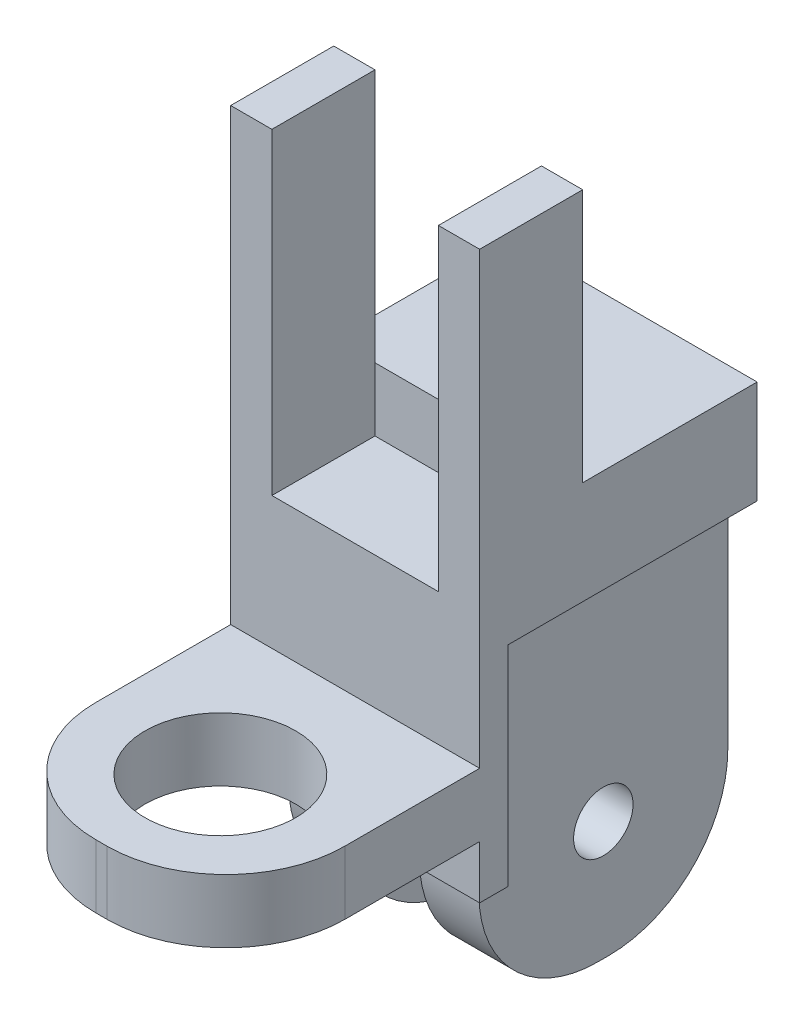
from build123d import *

# Parameters (mm, degrees)
SKETCH4_W            = 31.4
SKETCH4_H            = 31.4
SKETCH4_W_2          = 25.4
SKETCH4_H_2          = 25.4
BOSS_EXTRUDE3_DEPTH  = 30
SKETCH5_W            = 31.4
SKETCH5_H            = 31.4
BOSS_EXTRUDE4_DEPTH  = 5
SKETCH6_W            = 31.4
SKETCH6_H            = 8
BOSS_EXTRUDE5_DEPTH  = 5
BOSS_EXTRUDE6_DEPTH  = 8
SKETCH8_R            = 9.5
BOSS_EXTRUDE7_DEPTH  = 8
SKETCH9_W            = 31.4
SKETCH9_H            = 10
BOSS_EXTRUDE8_DEPTH  = 5
SKETCH10_W           = 31.4
SKETCH10_H           = 10
BOSS_EXTRUDE9_DEPTH  = 13
SKETCH11_W           = 5.2
SKETCH11_H           = 10
BOSS_EXTRUDE10_DEPTH = 40
BOSS_EXTRUDE11_DEPTH = 3
SKETCH13_W           = 31.4
SKETCH13_H           = 31.4
CUT_EXTRUDE1_DEPTH   = 31.4
SKETCH15_W           = 31.4
SKETCH15_H           = 13
BOSS_EXTRUDE12_DEPTH = 12
SKETCH17_W           = 7.5
SKETCH17_H           = 31.4
BOSS_EXTRUDE13_DEPTH = 10
SKETCH18_R           = 3.75
BOSS_EXTRUDE14_DEPTH = 7.5
SKETCH19_W           = 3.6
SKETCH19_H           = 5
CUT_EXTRUDE2_DEPTH   = 31.4
CUT_EXTRUDE3_START   = 8
SKETCH8_2_R          = 9.5
CUT_EXTRUDE3_DEPTH   = 24
SKETCH20_W           = 9
SKETCH20_H           = 1
CUT_EXTRUDE4_DEPTH   = 26.4


with BuildPart() as part:
    # Sketch4 → Boss-Extrude3 (new body)
    with BuildSketch(Plane.XY):
        Rectangle(SKETCH4_W, SKETCH4_H)
        Rectangle(SKETCH4_W_2, SKETCH4_H_2, mode=Mode.SUBTRACT)
    extrude(amount=BOSS_EXTRUDE3_DEPTH)

    # Sketch5 → Boss-Extrude4 (add)
    with BuildSketch(Plane.XY.offset(30)):
        Rectangle(SKETCH5_W, SKETCH5_H)
    extrude(amount=BOSS_EXTRUDE4_DEPTH)

    # Sketch6 → Boss-Extrude5 (add)
    with BuildSketch(Plane.XY.offset(35)):
        Rectangle(SKETCH6_W, SKETCH6_H)
    extrude(amount=BOSS_EXTRUDE5_DEPTH)

    # Sketch7 → Boss-Extrude6 (add)
    with BuildSketch(Plane.XZ.offset(4)):
        with BuildLine():
            Line((-15.7, 40), (-15.7, 52))
            ThreePointArc((-15.7, 52), (-11.306601718, 62.606601718), (-0.7, 67))
            Line((-0.7, 67), (0.7, 67))
            ThreePointArc((0.7, 67), (11.306601718, 62.606601718), (15.7, 52))
            Line((15.7, 52), (15.7, 40))
            Line((15.7, 40), (-15.7, 40))
        make_face()
    extrude(amount=-BOSS_EXTRUDE6_DEPTH)

    # Sketch8 → Boss-Extrude7 (add)
    with BuildSketch(Plane.XZ.offset(4)):
        with Locations((0, 52)):
            Circle(SKETCH8_R)
    boss_extrude7 = extrude(amount=BOSS_EXTRUDE7_DEPTH)

    # Mirror1: Boss-Extrude7 across plane
    add(boss_extrude7.mirror(Plane.ZX))

    # Sketch9 → Boss-Extrude8 (add)
    with BuildSketch(Plane(origin=(0, 15.7, 0), x_dir=(1, 0, 0), z_dir=(0, 1, 0))):
        with Locations((0, -27)):
            Rectangle(SKETCH9_W, SKETCH9_H)
    extrude(amount=BOSS_EXTRUDE8_DEPTH)

    # Sketch10 → Boss-Extrude9 (add)
    with BuildSketch(Plane(origin=(0, 15.7, 0), x_dir=(1, 0, 0), z_dir=(0, 1, 0))):
        with Locations((0, -17)):
            Rectangle(SKETCH10_W, SKETCH10_H)
    extrude(amount=BOSS_EXTRUDE9_DEPTH)

    # Sketch11 → Boss-Extrude10 (add)
    with BuildSketch(Plane(origin=(0, 20.7, 0), x_dir=(1, 0, 0), z_dir=(0, 1, 0))):
        with Locations((-13.1, -27)):
            Rectangle(SKETCH11_W, SKETCH11_H)
        with Locations((13.1, -27)):
            Rectangle(SKETCH11_W, SKETCH11_H)
    extrude(amount=BOSS_EXTRUDE10_DEPTH)

    # Sketch12 → Boss-Extrude11 (add)
    with BuildSketch(Plane.XY.offset(32)):
        Polygon((-15.7, 60.7), (-10.5, 60.7), (-10.5, 20.7), (10.5, 20.7), (10.5, 60.7), (15.7, 60.7), (15.7, 15.7), (-15.7, 15.7), align=None)
    extrude(amount=BOSS_EXTRUDE11_DEPTH)

    # Sketch13 → Cut-Extrude1 (cut)
    with BuildSketch(Plane.ZY.offset(15.7)):
        with Locations((15.7, 0)):
            Rectangle(SKETCH13_W, SKETCH13_H)
    extrude(amount=-CUT_EXTRUDE1_DEPTH, mode=Mode.SUBTRACT)

    # Sketch15 → Boss-Extrude12 (add)
    with BuildSketch(Plane(origin=(0, 0, 12), x_dir=(-1, 0, 0), z_dir=(0, 0, -1))):
        with Locations((0, 22.2)):
            Rectangle(SKETCH15_W, SKETCH15_H)
    extrude(amount=BOSS_EXTRUDE12_DEPTH)

    # Sketch17 → Boss-Extrude13 (add)
    with BuildSketch(Plane.XZ.offset(-15.7)):
        with Locations((-8.25, 15.7)):
            Rectangle(SKETCH17_W, SKETCH17_H)
    boss_extrude13 = extrude(amount=BOSS_EXTRUDE13_DEPTH)

    # Sketch18 → Boss-Extrude14 (add)
    with BuildSketch(Plane.ZY.offset(12)):
        with BuildLine():
            Line((31.4, 5.7), (0, 5.7))
            Line((0, 5.7), (0, -13.3))
            ThreePointArc((0, -13.3), (4.393398282, -23.906601718), (15, -28.3))
            Line((15, -28.3), (16.4, -28.3))
            ThreePointArc((16.4, -28.3), (27.006601718, -23.906601718), (31.4, -13.3))
            Line((31.4, -13.3), (31.4, 5.7))
        make_face()
        with Locations((15.7, -13.3)):
            Circle(SKETCH18_R, mode=Mode.SUBTRACT)
    boss_extrude14 = extrude(amount=-BOSS_EXTRUDE14_DEPTH)

    # Mirror3: Boss-Extrude13, Boss-Extrude14 across plane
    add(boss_extrude13.mirror(Plane(origin=(0, 0, 0), x_dir=(0, 0, 1), z_dir=(1, 0, 0))))
    add(boss_extrude14.mirror(Plane(origin=(0, 0, 0), x_dir=(0, 0, 1), z_dir=(1, 0, 0))))

    # Sketch19 → Cut-Extrude2 (cut)
    with BuildSketch(Plane(origin=(15.7, 0, 0), x_dir=(0, 0, -1), z_dir=(1, 0, 0))):
        with Locations((-33.2, -13.2)):
            Rectangle(SKETCH19_W, SKETCH19_H)
    extrude(amount=-CUT_EXTRUDE2_DEPTH, mode=Mode.SUBTRACT)

    # Sketch8<2> → Cut-Extrude3 (cut)
    with BuildSketch(Plane.XZ.offset(4).offset(CUT_EXTRUDE3_START)):
        with Locations((0, 52)):
            Circle(SKETCH8_2_R)
    extrude(amount=-CUT_EXTRUDE3_DEPTH, mode=Mode.SUBTRACT)

    # Sketch20 → Cut-Extrude4 (cut)
    with BuildSketch(Plane.XZ.offset(10.7)):
        with Locations((0, 31.9)):
            Rectangle(SKETCH20_W, SKETCH20_H)
    extrude(amount=-CUT_EXTRUDE4_DEPTH, mode=Mode.SUBTRACT)


solid = part.part
